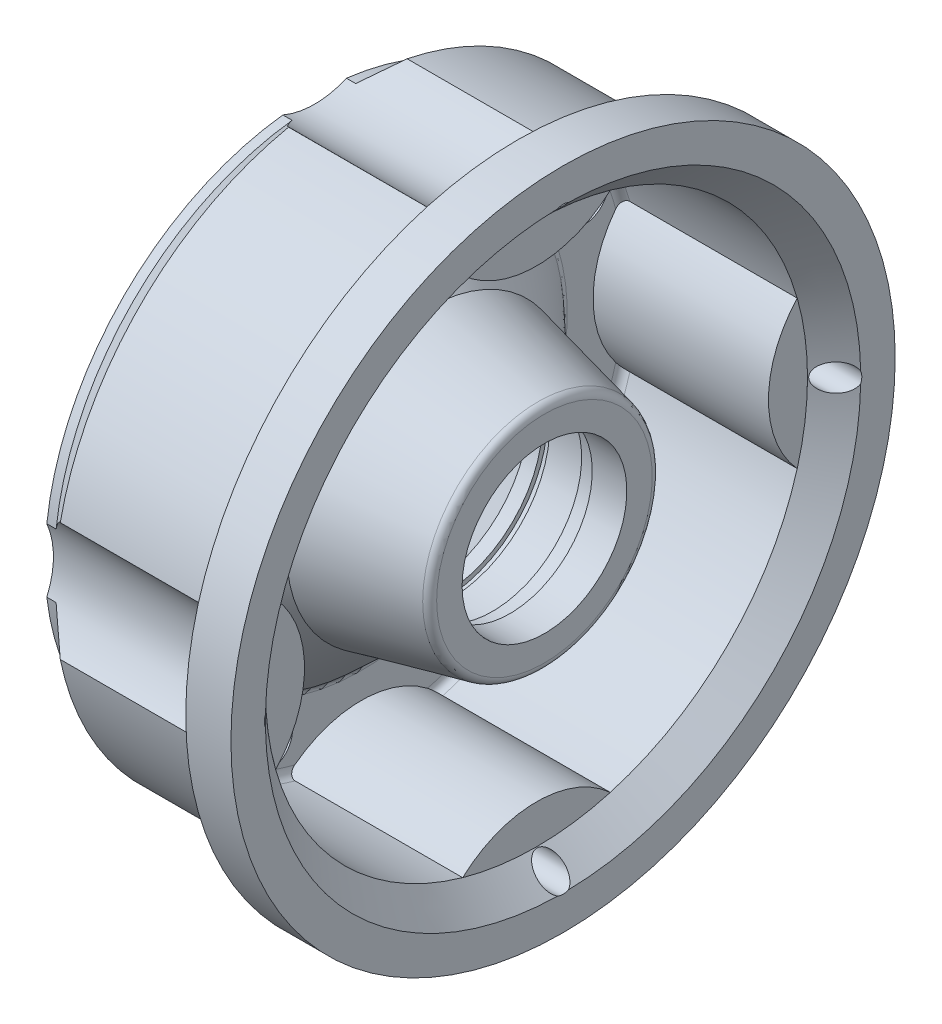
from build123d import *

# Parameters (mm, degrees)
EXTRUDE_1_REACH             = 194.619
EXTRUDE_1_DIRECTION_2_DEPTH = 7
PATTERN_CIRCULAR_1_COUNT    = 4
CUT_EXTRUDE_2_DEPTH         = 193.619443463
PATTERN_CIRCULAR_2_COUNT    = 4
HOLE_WIZARD_M12_1_D         = 10.2
HOLE_WIZARD_M12_1_DEPTH     = 17.001
PATTERN_CIRCULAR_3_COUNT    = 4
CUT_EXTRUDE_START           = -3.5
CUT_EXTRUDE_3_DEPTH         = 3.5
SKETCH_8_R                  = 5.5
CUT_EXTRUDE_4_DEPTH         = 193.421412569
PATTERN_CIRCULAR_4_COUNT    = 8


# Read off the part's stored shape, not the designer's step: 切除-拉伸3
with BuildPart() as part:
    # 草图1 → 旋转1 (revolve)
    with BuildSketch(Plane(origin=(0, 0, 0), x_dir=(1, 0, 0), z_dir=(0, 1, 0))):
        with BuildLine():
            Line((0, -97.5), (0, -101.5))
            Line((0, -101.5), (3.5, -101.5))
            Line((3.5, -101.5), (12.5, -110.5))
            Line((12.5, -110.5), (73.5, -110.5))
            ThreePointArc((73.5, -110.5), (75.621320344, -111.378679656), (76.5, -113.5))
            Line((76.5, -113.5), (76.5, -125))
            Line((76.5, -125), (93.5, -125))
            Line((93.5, -125), (93.5, -112.029157667))
            Line((93.5, -112.029157667), (83.470842333, -102))
            Line((83.470842333, -102), (20.5, -102))
            ThreePointArc((20.5, -102), (18.378679656, -101.121320344), (17.5, -99))
            Line((17.5, -99), (17.5, -77.596696777))
            ThreePointArc((17.5, -77.596696777), (17.749094281, -76.399818453), (18.455011816, -75.401697159))
            Line((18.455011816, -75.401697159), (42.5, -53))
            Line((42.5, -53), (84.166882613, -43.5))
            ThreePointArc((84.166882613, -43.5), (85.845276939, -42.445803218), (86.5, -40.575061098))
            Line((86.5, -40.575061098), (86.5, -31))
            Line((86.5, -31), (73.5, -31))
            Line((73.5, -31), (73.5, -32.5))
            ThreePointArc((73.5, -32.5), (73.207106781, -33.207106781), (72.5, -33.5))
            Line((72.5, -33.5), (67, -33.5))
            Line((67, -33.5), (67, -37.5))
            Line((67, -37.5), (51, -37.5))
            Line((51, -37.5), (51, -39.25))
            Line((51, -39.25), (48.3, -39.25))
            Line((48.3, -39.25), (48.3, -37.5))
            Line((48.3, -37.5), (43, -37.5))
            Line((43, -37.5), (11.5, -66.847215939))
            Line((11.5, -66.847215939), (11.5, -72.5))
            Line((11.5, -72.5), (8.5, -72.5))
            Line((8.5, -72.5), (8.5, -80))
            Line((8.5, -80), (3.5, -80))
            Line((3.5, -80), (3.5, -97.5))
            Line((3.5, -97.5), (0, -97.5))
        make_face()
    revolve(axis=Axis((-80.453563715, 0, 0), (1, 0, 0)))

    # 草图2 → 凸台-拉伸1 (add, up to next)
    with BuildSketch(Plane.ZY.offset(-76.5), mode=Mode.PRIVATE) as extrude_1_sk1:
        with BuildLine():
            ThreePointArc((-27.778205682, 98.14464473), (0, 87.300428405), (27.778205682, 98.14464473))
            ThreePointArc((27.778205682, 98.14464473), (0, 102), (-27.778205682, 98.14464473))
        make_face()
    extrude_1_tool1 = extrude(extrude_1_sk1.sketch, amount=EXTRUDE_1_REACH, mode=Mode.PRIVATE) - part.part
    extrude_1 = extrude_1_tool1.solids().sort_by_distance((76.5, 95.281273, 0))[0]
    add(extrude_1)

    # 草图2 → 凸台-拉伸1 direction 2 (add)
    with BuildSketch(Plane.ZY.offset(-76.5)):
        with BuildLine():
            ThreePointArc((-27.778205682, 98.14464473), (0, 87.300428405), (27.778205682, 98.14464473))
            ThreePointArc((27.778205682, 98.14464473), (0, 102), (-27.778205682, 98.14464473))
        make_face()
    extrude_1_direction_2 = extrude(amount=-EXTRUDE_1_DIRECTION_2_DEPTH)

    # 阵列(圆周)1: 凸台-拉伸1, 凸台-拉伸1 direction 2 ×4 about axis
    pattern_circular_1_axis = Axis((0, 0, 0), (1, 0, 0))
    add([extrude_1.rotate(pattern_circular_1_axis, i * 360 / PATTERN_CIRCULAR_1_COUNT) for i in range(1, PATTERN_CIRCULAR_1_COUNT)])
    add([extrude_1_direction_2.rotate(pattern_circular_1_axis, i * 360 / PATTERN_CIRCULAR_1_COUNT) for i in range(1, PATTERN_CIRCULAR_1_COUNT)])

    # 草图3 → 切除-拉伸2 (cut, through all)
    with BuildSketch(Plane.ZY.offset(-76.5)):
        with BuildLine():
            ThreePointArc((-24.399849105, 110.846278078), (0, 98.300428405), (24.399849105, 110.846278078))
            ThreePointArc((24.399849105, 110.846278078), (0, 113.5), (-24.399849105, 110.846278078))
        make_face()
    cut_extrude_2 = extrude(amount=CUT_EXTRUDE_2_DEPTH, mode=Mode.SUBTRACT)

    # 阵列(圆周)2: 切除-拉伸2 ×4 about axis
    pattern_circular_2_axis = Axis((0, 0, 0), (1, 0, 0))
    for i in range(1, PATTERN_CIRCULAR_2_COUNT):
        add(cut_extrude_2.rotate(pattern_circular_2_axis, i * 360 / PATTERN_CIRCULAR_2_COUNT), mode=Mode.SUBTRACT)

    # M12 螺纹孔的螺纹孔钻头1
    with Locations(Plane(origin=(76.5, 0, -107.339786191), x_dir=(0, 0, -1), z_dir=(-1, 0, 0))):
        with Locations((0, 0)):
            hole_wizard_m12_1 = Hole(HOLE_WIZARD_M12_1_D / 2, depth=HOLE_WIZARD_M12_1_DEPTH)

    # 阵列(圆周)3: M12 螺纹孔的螺纹孔钻头1 ×4 about axis
    pattern_circular_3_axis = Axis((0, 0, 0), (1, 0, 0))
    for i in range(1, PATTERN_CIRCULAR_3_COUNT):
        add(hole_wizard_m12_1.rotate(pattern_circular_3_axis, i * 360 / PATTERN_CIRCULAR_3_COUNT), mode=Mode.SUBTRACT)

    # 切除-拉伸3 outline → 切除-拉伸3 (cut)
    with BuildSketch(Plane(origin=(17.5, 0, 0), x_dir=(0, 0, -1), z_dir=(1, 0, 0)).offset(CUT_EXTRUDE_START)):
        with BuildLine():
            ThreePointArc((33.877685954, 93.023128277), (31.380041453, 75.758121666), (41.822143342, 89.732426281))
            ThreePointArc((41.822143342, 89.732426281), (37.885659804, 91.464073719), (33.877685954, 93.023128277))
        make_face()
    cut_extrude_3 = extrude(amount=CUT_EXTRUDE_3_DEPTH, mode=Mode.SUBTRACT)

    # 草图8 → 切除-拉伸4 (cut, through all)
    with BuildSketch(Plane(origin=(17.5, 0, 0), x_dir=(0, 0, -1), z_dir=(1, 0, 0))):
        with Locations((34.824192345, 84.073037459)):
            Circle(SKETCH_8_R)
    cut_extrude_4 = extrude(amount=-CUT_EXTRUDE_4_DEPTH, mode=Mode.SUBTRACT)

    # 阵列(圆周)4: 切除-拉伸3, 切除-拉伸4 ×8 about axis
    pattern_circular_4_axis = Axis((0, 0, 0), (1, 0, 0))
    add([cut_extrude_3.rotate(pattern_circular_4_axis, i * 360 / PATTERN_CIRCULAR_4_COUNT) for i in range(1, PATTERN_CIRCULAR_4_COUNT)], mode=Mode.SUBTRACT)
    add([cut_extrude_4.rotate(pattern_circular_4_axis, i * 360 / PATTERN_CIRCULAR_4_COUNT) for i in range(1, PATTERN_CIRCULAR_4_COUNT)], mode=Mode.SUBTRACT)


solid = part.part
